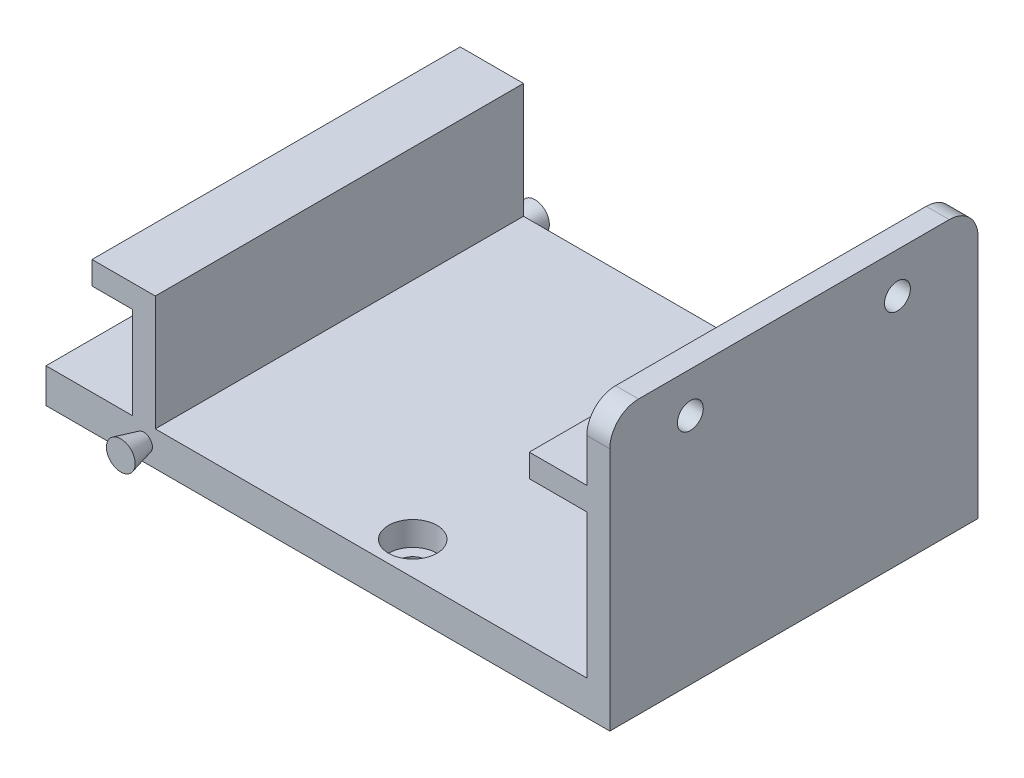
from build123d import *

# Parameters (mm, degrees)
EXTRUDE_BASE_DEPTH              = 32
SKETCH2_R                       = 2.2
SKETCH2_R_2                     = 2.2479
CUT_BOLT_HOLES_DEPTH            = 10
CUT_BOLT_HEAD_INSETS_DEPTH      = 40
CUT_BOLT_HEAD_INSETS_DEPTH_BACK = 4.2
SKETCH3_R                       = 4.215
SKETCH4_W                       = 40
SKETCH4_H                       = 3
CUT_TOP_CLEARANCE_SLOT_DEPTH    = 45
FILLET_CLEARANCE_SLOT_PT_1_R    = 3
FILLET_CLEARANCE_SLOT_PT_2_R    = 3
SKETCH5_R                       = 1.5
BOSS_EXTRUDE1_DEPTH             = 4
SKETCH6_R                       = 2.5
SKETCH7_R                       = 1.5
BOSS_EXTRUDE2_DEPTH             = 4
SKETCH9_R                       = 2.2479
BOSS_EXTRUDE3_DEPTH             = 4


with BuildPart() as part:
    # Sketch1 → Extrude-Base (new, symmetric)
    with BuildSketch(Plane.XY):
        Polygon((-14, 0), (0, 0), (0, -35), (-98, -35), (-98, -29), (-83, -29), (-83, -13), (-90, -13), (-90, -9), (-79, -9), (-79, -29), (-4, -29), (-4, -4), (-14, -4), align=None)
    extrude(amount=EXTRUDE_BASE_DEPTH, both=True)

    # Sketch2 → Cut-Bolt Holes (cut)
    with BuildSketch(Plane(origin=(0, -29, 0), x_dir=(1, 0, 0), z_dir=(0, 1, 0))):
        with Locations(Location((-15, -10, 0), (0, 0, 270))):
            Circle(SKETCH2_R)
        with Locations(Location((-15, 10, 0), (0, 0, 180))):
            Circle(SKETCH2_R)
        with Locations(Location((-40, 26.25, 0), (0, 0, 270))):
            Circle(SKETCH2_R_2)
        with Locations(Location((-40, -26.25, 0), (0, 0, 270))):
            Circle(SKETCH2_R_2)
    extrude(amount=-CUT_BOLT_HOLES_DEPTH, mode=Mode.SUBTRACT)

    # Sketch3 → Cut-Bolt Head Insets (cut, two sides: drawn at the far end of the back side and taken through both)
    with BuildSketch(Plane(origin=(0, -29, 0), x_dir=(1, 0, 0), z_dir=(0, 1, 0)).offset(-CUT_BOLT_HEAD_INSETS_DEPTH_BACK)):
        with Locations((-15, -10)):
            Circle(SKETCH3_R)
        with Locations((-40, -26.25)):
            Circle(SKETCH3_R)
        with Locations(Location((-15, 10, 0), (0, 0, 90))):
            Circle(SKETCH3_R)
        with Locations(Location((-40, 26.25, 0), (0, 0, 90))):
            Circle(SKETCH3_R)
    extrude(amount=CUT_BOLT_HEAD_INSETS_DEPTH + CUT_BOLT_HEAD_INSETS_DEPTH_BACK, mode=Mode.SUBTRACT)

    # Sketch4 → Cut-Top Clearance Slot (cut)
    with BuildSketch(Plane.ZY.offset(98)):
        with Locations((0, -33.5)):
            Rectangle(SKETCH4_W, SKETCH4_H)
    extrude(amount=-CUT_TOP_CLEARANCE_SLOT_DEPTH, mode=Mode.SUBTRACT)

    # Fillet-Clearance Slot Pt 1
    fillet_clearance_slot_pt_1_edges = [part.edges().sort_by_distance(p)[0] for p in [
        (-75.5, -32, 20),
        (-75.5, -32, -20),
    ]]
    fillet(fillet_clearance_slot_pt_1_edges, radius=FILLET_CLEARANCE_SLOT_PT_1_R - 0.0001)  # a hair under: the kernel refuses the full size

    # Fillet-Clearance Slot Pt 2
    # the kernel refuses this fillet: 3 mm, written as the material it takes off along each edge
    with BuildSketch(Plane(origin=(-103.490486718, -35, 20), x_dir=(0, 0, 1), z_dir=(1, 0, 0))) as fillet_clearance_slot_pt_2_piece_1:
        with BuildLine():
            CenterArc((2.196194687, -3), FILLET_CLEARANCE_SLOT_PT_2_R, 90, 60.000551337)
            Line((-0.401895958, -1.500025), (-0.661705022, -1.3500275))
            ThreePointArc((-0.661705022, -1.3500275), (-0.3, -0.0001), (-0.3, 0))
            Line((-0.3, 0), (0, 0.3))
            Line((0, 0.3), (2.196194687, 0.3))
            Line((2.196194687, 0.3), (2.196194687, 0))
        make_face()
    extrude(amount=50.490486718, mode=Mode.SUBTRACT)
    with BuildSketch(Plane(origin=(-103.490486718, -35, -20), x_dir=(0, 0.9659313848535173, 0.25879829936644894), z_dir=(1, 0, 0))) as fillet_clearance_slot_pt_2_piece_2:
        with BuildLine():
            CenterArc((2.329422704, -2.897768274), FILLET_CLEARANCE_SLOT_PT_2_R, 105.000679234, 60.000551337)
            Line((-0.56837145, -2.121373376), (-0.858150866, -2.043733886))
            Line((-0.858150866, -2.043733886), (-0.289779415, 0.07763949))
            Line((-0.289779415, 0.07763949), (0.07763949, 0.289779415))
            ThreePointArc((0.07763949, 0.289779415), (0.077736083, 0.289753536), (1.475282068, 0.289776827))
            Line((1.475282068, 0.289776827), (1.552931216, 0))
        make_face()
    extrude(amount=50.490486718, mode=Mode.SUBTRACT)

    # Sketch5 → Boss-Extrude1 (add)
    with BuildSketch(Plane.XY.offset(32)):
        with Locations(Location((-81, -32, 0), (0, 0, 180))):
            Circle(SKETCH5_R)
    extrude(amount=BOSS_EXTRUDE1_DEPTH)

    # Sketch6 → section 1 of loft2
    with BuildSketch(Plane.XY.offset(36), mode=Mode.PRIVATE) as loft2_s1:
        with Locations((-81, -32)):
            Circle(SKETCH6_R)
    # loft up to a face of the part (loft2)
    loft([Face(Wire([part.edges().sort_by_distance((-79.973179341, -33.093452941, 32))[0]])), loft2_s1.sketch])

    # Sketch7 → Boss-Extrude2 (add)
    with BuildSketch(Plane(origin=(0, 0, -32), x_dir=(-1, 0, 0), z_dir=(0, 0, -1))):
        with Locations((81, -32)):
            Circle(SKETCH7_R)
    extrude(amount=BOSS_EXTRUDE2_DEPTH)

    # Loft4: read off the stored shape, not the designer's step
    # Loft4: loft between two sections, ruled curve by curve
    loft4_from = [
        Edge.make_bspline([(-82.101258326, -29.755622559, -36), (-86.590013209, -31.95813921, -36), (-84.387496557, -36.446894093, -36), (-79.898741674, -34.244377441, -36), (-75.409986791, -32.04186079, -36), (-77.612503443, -27.553105907, -36), (-82.101258326, -29.755622559, -36)], [0, 0, 0, 0, 0.5, 0.5, 0.5, 1, 1, 1, 1], 3, [1, 0.333333333, 0.333333333, 1, 0.333333333, 0.333333333, 1]),
    ]
    loft4_to = [
        Edge.make_bspline([(-81.328134577, -30.536330741, -32), (-84.255473095, -31.192599896, -32), (-83.59920394, -34.119938413, -32), (-80.671865423, -33.463669259, -32), (-77.744526905, -32.807400104, -32), (-78.40079606, -29.880061587, -32), (-81.328134577, -30.536330741, -32)], [0, 0, 0, 0, 0.5, 0.5, 0.5, 1, 1, 1, 1], 3, [1, 0.333333333, 0.333333333, 1, 0.333333333, 0.333333333, 1]),
    ]
    loft4 = Solid(Shell([*[Face.make_surface_from_curves(loft4_from[k], loft4_to[k]) for k in range(1)], Face(Wire(loft4_from)), Face(Wire(loft4_to))]))
    add(loft4)

    # Sketch9 → Boss-Extrude3 (add)
    with BuildSketch(Plane(origin=(0, 0, 0), x_dir=(0, 0, -1), z_dir=(1, 0, 0))):
        with BuildLine():
            Line((32, 0), (-32, 0))
            Line((-32, 0), (-32, 7.5))
            ThreePointArc((-32, 7.5), (-30.535533906, 11.035533906), (-27, 12.5))
            Line((-27, 12.5), (27, 12.5))
            ThreePointArc((27, 12.5), (30.535533906, 11.035533906), (32, 7.5))
            Line((32, 7.5), (32, 0))
        make_face()
        with Locations(Location((-18, 5.5, 0), (0, 0, 90))):
            Circle(SKETCH9_R, mode=Mode.SUBTRACT)
        with Locations(Location((18, 5.5, 0), (0, 0, 90))):
            Circle(SKETCH9_R, mode=Mode.SUBTRACT)
    extrude(amount=-BOSS_EXTRUDE3_DEPTH)


solid = part.part
